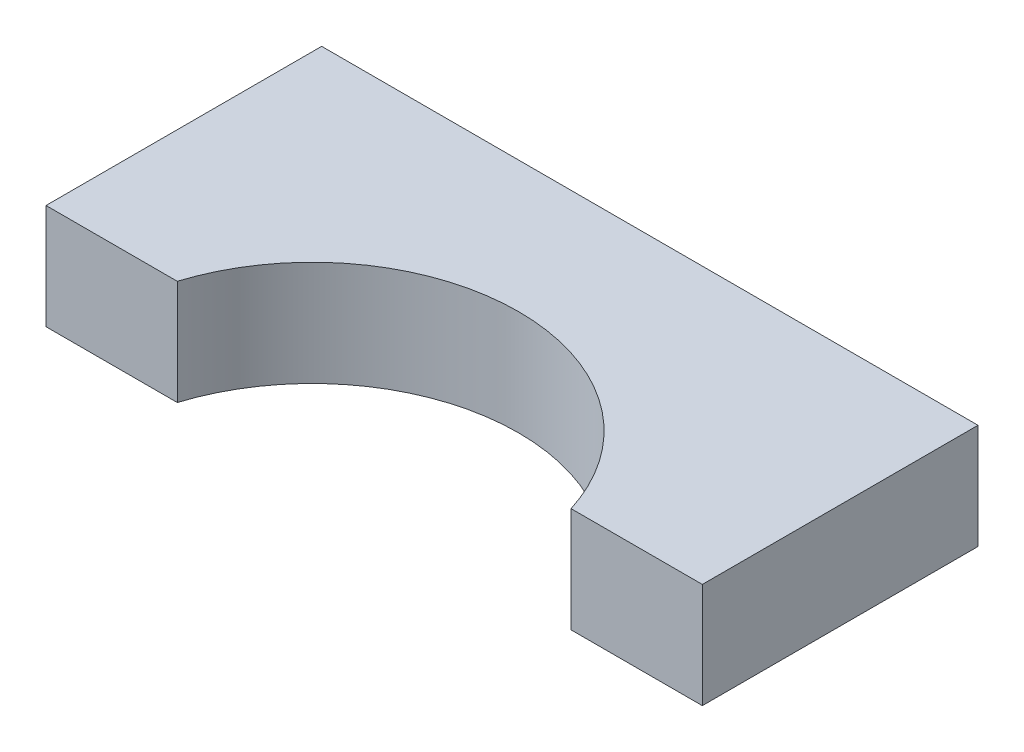
from build123d import *

# Parameters (mm, degrees)
BOSS_EXTRUDE1_DEPTH = 10.16


with BuildPart() as part:
    # Sketch2 → Boss-Extrude1 (new body)
    with BuildSketch(Plane(origin=(0, 0, 0), x_dir=(1, 0, 0), z_dir=(0, 1, 0))):
        with BuildLine():
            Line((19.05, -13.97), (31.75, -13.97))
            Line((31.75, -13.97), (31.75, 12.7))
            Line((31.75, 12.7), (-31.75, 12.7))
            Line((-31.75, 12.7), (-31.75, -13.97))
            Line((-31.75, -13.97), (-19.05, -13.97))
            ThreePointArc((-19.05, -13.97), (0, 0), (19.05, -13.97))
        make_face()
    extrude(amount=-BOSS_EXTRUDE1_DEPTH)


solid = part.part
